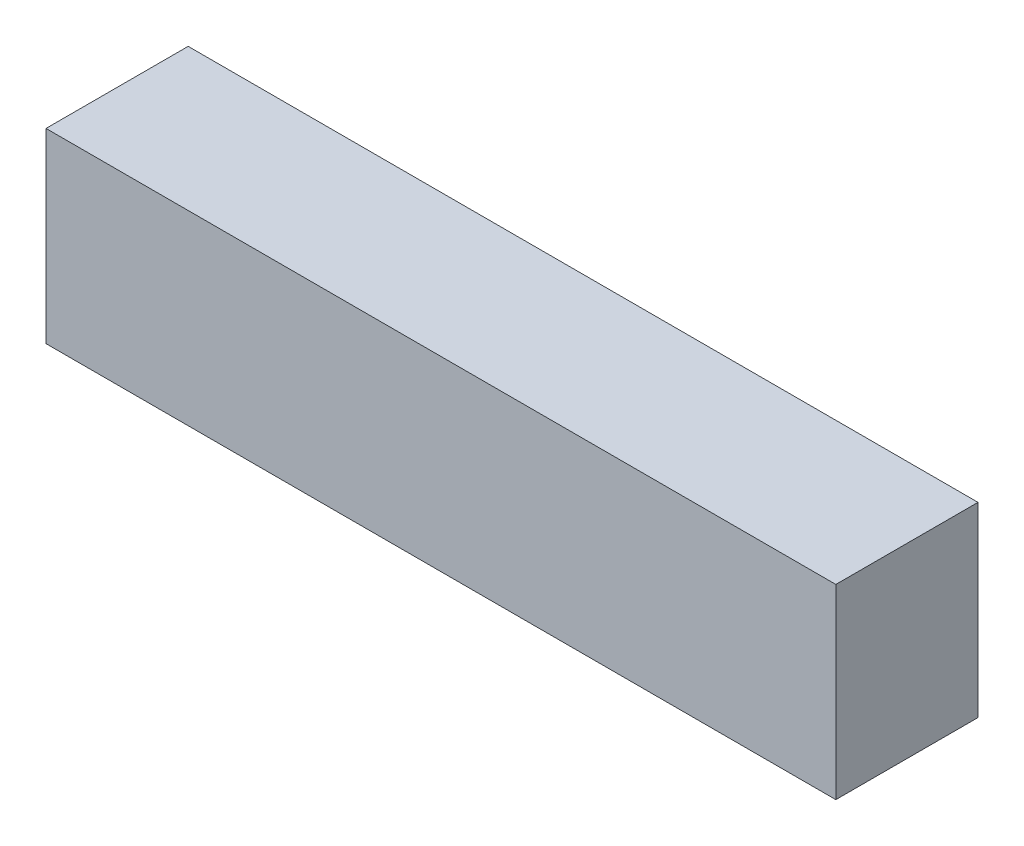
from build123d import *

# Parameters (mm, degrees)
SKETCH1_W           = 63.5
SKETCH1_H           = 14.986
BOSS_EXTRUDE1_DEPTH = 11.43


with BuildPart() as part:
    # Sketch1 → Boss-Extrude1 (new body)
    with BuildSketch(Plane.XY):
        with Locations((-52.194689379, -13.806398798)):
            Rectangle(SKETCH1_W, SKETCH1_H)
    extrude(amount=BOSS_EXTRUDE1_DEPTH)


solid = part.part
